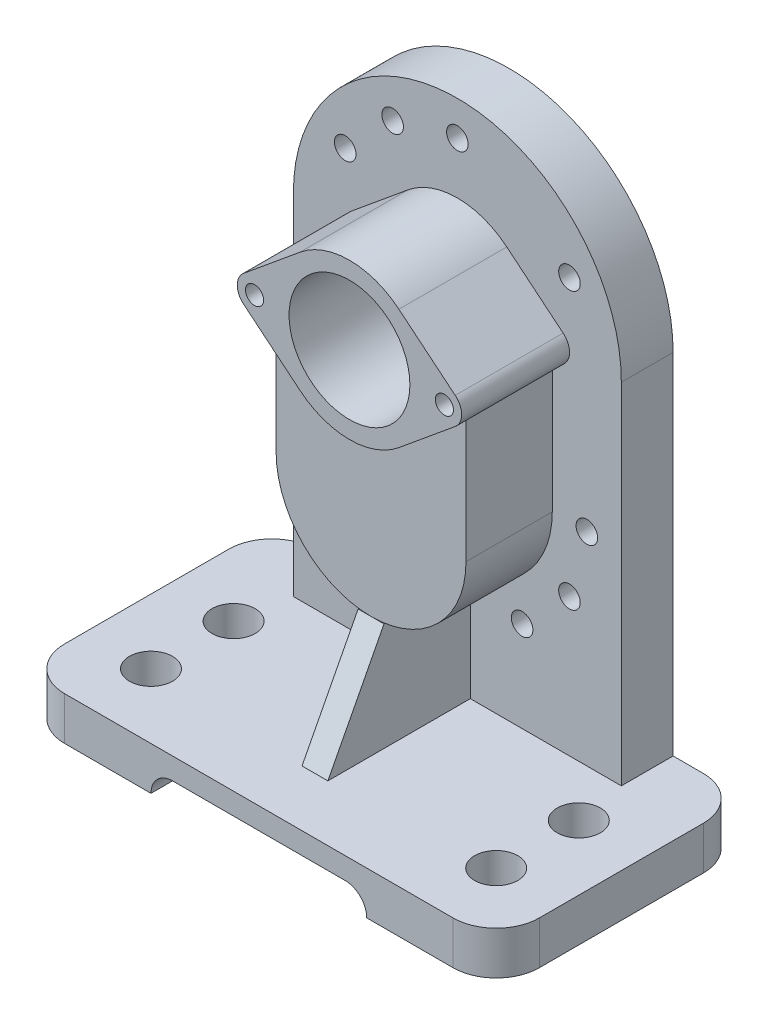
from build123d import *

# Parameters (mm, degrees)
SKETCH_1_W                  = 110
SKETCH_1_H                  = 58
SKETCH_1_R                  = 5
EXTRUDE_1_DEPTH             = 10
SKETCH_2_W                  = 25
SKETCH_2_H                  = 5
CUT_EXTRUDE_1_DEPTH         = 84.500964144
FILLET_2_R                  = 5
FILLET_3_R                  = 10
SKETCH_4_R                  = 2.5
EXTRUDE_2_DEPTH             = 12
EXTRUDE_14_DEPTH            = 20
HOLE_WIZARD_18_0_18_1_D     = 18
HOLE_WIZARD_18_0_18_1_DEPTH = 15
HOLE_WIZARD_18_0_18_1_TIP   = 5.407745571
SKETCH_7_3_R                = 14
EXTRUDE_16_DEPTH            = 25
HOLE_WIZARD_M5_1_D          = 4.2
HOLE_WIZARD_M5_1_DEPTH      = 15
HOLE_WIZARD_M5_1_TIP        = 1.2618073
EXTRUDE_19_DEPTH            = 3


with BuildPart() as part:
    # 草图1 → 凸台-拉伸1 (new body)
    with BuildSketch(Plane(origin=(0, 0, 0), x_dir=(1, 0, 0), z_dir=(0, 1, 0))):
        with Locations((4.231841208, -6.803439809)):
            Rectangle(SKETCH_1_W, SKETCH_1_H)
        with Locations(Location((44.231841208, -20.803439809, 0), (0, 0, 270))):
            Circle(SKETCH_1_R, mode=Mode.SUBTRACT)
        with Locations(Location((-35.768158792, -20.803439809, 0), (0, 0, 90))):
            Circle(SKETCH_1_R, mode=Mode.SUBTRACT)
        with Locations(Location((-35.768158792, -1.66433068, 0), (0, 0, 270))):
            Circle(SKETCH_1_R, mode=Mode.SUBTRACT)
        with Locations(Location((44.231841208, -1.66433068, 0), (0, 0, 270))):
            Circle(SKETCH_1_R, mode=Mode.SUBTRACT)
    extrude(amount=EXTRUDE_1_DEPTH)

    # 草图2 → 切除-拉伸1 (cut, through all)
    with BuildSketch(Plane.XY.offset(35.803439809)):
        with Locations((-8.268158792, 2.5)):
            Rectangle(SKETCH_2_W, SKETCH_2_H)
        with Locations((16.731841208, 2.5)):
            Rectangle(SKETCH_2_W, SKETCH_2_H)
    extrude(amount=-CUT_EXTRUDE_1_DEPTH, mode=Mode.SUBTRACT)

    # 圆角2
    fillet_2_edges = [part.edges().sort_by_distance(p)[0] for p in [
        (29.231841208, 5, 6.803439809),
        (-20.768158792, 5, 6.803439809),
    ]]
    fillet(fillet_2_edges, radius=FILLET_2_R - 0.0001)  # a hair under: the kernel refuses the full size

    # 圆角3
    fillet_3_edges = [part.edges().sort_by_distance(p)[0] for p in [
        (-50.768158792, 5, -22.196560191),
        (59.231841208, 5, -22.196560191),
        (59.231841208, 5, 35.803439809),
        (-50.768158792, 5, 35.803439809),
    ]]
    fillet(fillet_3_edges, radius=FILLET_3_R)

    # 草图4 → 凸台-拉伸2 (add)
    with BuildSketch(Plane(origin=(0, 0, -22.196560191), x_dir=(-1, 0, 0), z_dir=(0, 0, -1))):
        with BuildLine():
            Line((33.768158792, 91), (33.768158792, 10))
            Line((33.768158792, 10), (-42.231841208, 10))
            Line((-42.231841208, 10), (-42.231841208, 91))
            ThreePointArc((-42.231841208, 91), (-4.231841208, 129), (33.768158792, 91))
        make_face()
        with Locations((-4.231841208, 121)):
            Circle(SKETCH_4_R, mode=Mode.SUBTRACT)
        with Locations((10.768158792, 116.980762114)):
            Circle(SKETCH_4_R, mode=Mode.SUBTRACT)
        with Locations((-30.212603322, 106)):
            Circle(SKETCH_4_R, mode=Mode.SUBTRACT)
        with Locations((-34.231841208, 57)):
            Circle(SKETCH_4_R, mode=Mode.SUBTRACT)
        with Locations((-19.231841208, 31.019237886)):
            Circle(SKETCH_4_R, mode=Mode.SUBTRACT)
        with Locations((-30.212603322, 42)):
            Circle(SKETCH_4_R, mode=Mode.SUBTRACT)
        with Locations((25.768158792, 57)):
            Circle(SKETCH_4_R, mode=Mode.SUBTRACT)
        with Locations((10.768158792, 31.019237886)):
            Circle(SKETCH_4_R, mode=Mode.SUBTRACT)
        with Locations((21.748920905, 106)):
            Circle(SKETCH_4_R, mode=Mode.SUBTRACT)
    extrude(amount=-EXTRUDE_2_DEPTH)

    # 草图7 → 凸台-拉伸14 (add)
    with BuildSketch(Plane.XY.offset(-10.196560191)):
        with BuildLine():
            Line((-7.223056342, 77.115284587), (-17.768158792, 85.814999679))
            Line((-17.768158792, 85.814999679), (-17.768158792, 57))
            ThreePointArc((-17.768158792, 57), (4.231841208, 35), (26.231841208, 57))
            Line((26.231841208, 57), (26.231841208, 85.814999681))
            Line((26.231841208, 85.814999681), (15.68673876, 77.115284589))
            ThreePointArc((15.68673876, 77.115284589), (4.231841209, 73.000000001), (-7.223056342, 77.115284587))
        make_face()
    extrude(amount=EXTRUDE_14_DEPTH)

    # Ø18.0 (18) 直径孔1
    with Locations(Plane(origin=(4.231841208, 91, -22.196560191), x_dir=(-1, 0, 0), z_dir=(0, 0, -1))):
        with Locations((0, 0), (0, -34)):
            Hole(HOLE_WIZARD_18_0_18_1_D / 2, depth=HOLE_WIZARD_18_0_18_1_DEPTH)
            with Locations((0, 0, -(HOLE_WIZARD_18_0_18_1_DEPTH + HOLE_WIZARD_18_0_18_1_TIP / 2))):  # 118° drill point
                Cone(0, HOLE_WIZARD_18_0_18_1_D / 2, HOLE_WIZARD_18_0_18_1_TIP, mode=Mode.SUBTRACT)

    # 草图7<3> → 凸台-拉伸16 (add)
    with BuildSketch(Plane.XY.offset(-10.196560191)):
        with BuildLine():
            Line((-20.268158792, 94.122499), (-7.223056342, 104.884715413))
            ThreePointArc((-7.223056342, 104.884715413), (4.231841209, 108.999999999), (15.68673876, 104.884715411))
            Line((15.68673876, 104.884715411), (28.731841117, 94.122499073))
            ThreePointArc((28.731841117, 94.122499073), (30.231841209, 91), (28.731841117, 87.877500927))
            Line((28.731841117, 87.877500927), (15.68673876, 77.115284589))
            ThreePointArc((15.68673876, 77.115284589), (4.231841209, 73.000000001), (-7.223056342, 77.115284587))
            Line((-7.223056342, 77.115284587), (-20.268158792, 87.877501))
            ThreePointArc((-20.268158792, 87.877501), (-21.768158793, 91), (-20.268158792, 94.122499))
        make_face()
        with Locations((4.231841208, 91)):
            Circle(SKETCH_7_3_R, mode=Mode.SUBTRACT)
    extrude(amount=EXTRUDE_16_DEPTH)

    # M5 螺纹孔1
    with Locations(Plane(origin=(-17.768158792, 91, 14.803439809), x_dir=(1, 0, 0), z_dir=(0, 0, 1))):
        with Locations((0, 0), (44, 0)):
            Hole(HOLE_WIZARD_M5_1_D / 2, depth=HOLE_WIZARD_M5_1_DEPTH)
            with Locations((0, 0, -(HOLE_WIZARD_M5_1_DEPTH + HOLE_WIZARD_M5_1_TIP / 2))):  # 118° drill point
                Cone(0, HOLE_WIZARD_M5_1_D / 2, HOLE_WIZARD_M5_1_TIP, mode=Mode.SUBTRACT)


with BuildPart() as body_2:
    # 草图22 → 凸台-拉伸19 (new, symmetric)
    with BuildSketch(Plane(origin=(4.231841208, 0, 0), x_dir=(0, 0, -1), z_dir=(1, 0, 0))):
        Polygon((-9.803439809, 35), (10.196560191, 35), (10.196560191, 10), (-22.803439809, 10), align=None)
    extrude(amount=EXTRUDE_19_DEPTH, both=True)


solid = Compound([part.part, body_2.part])
